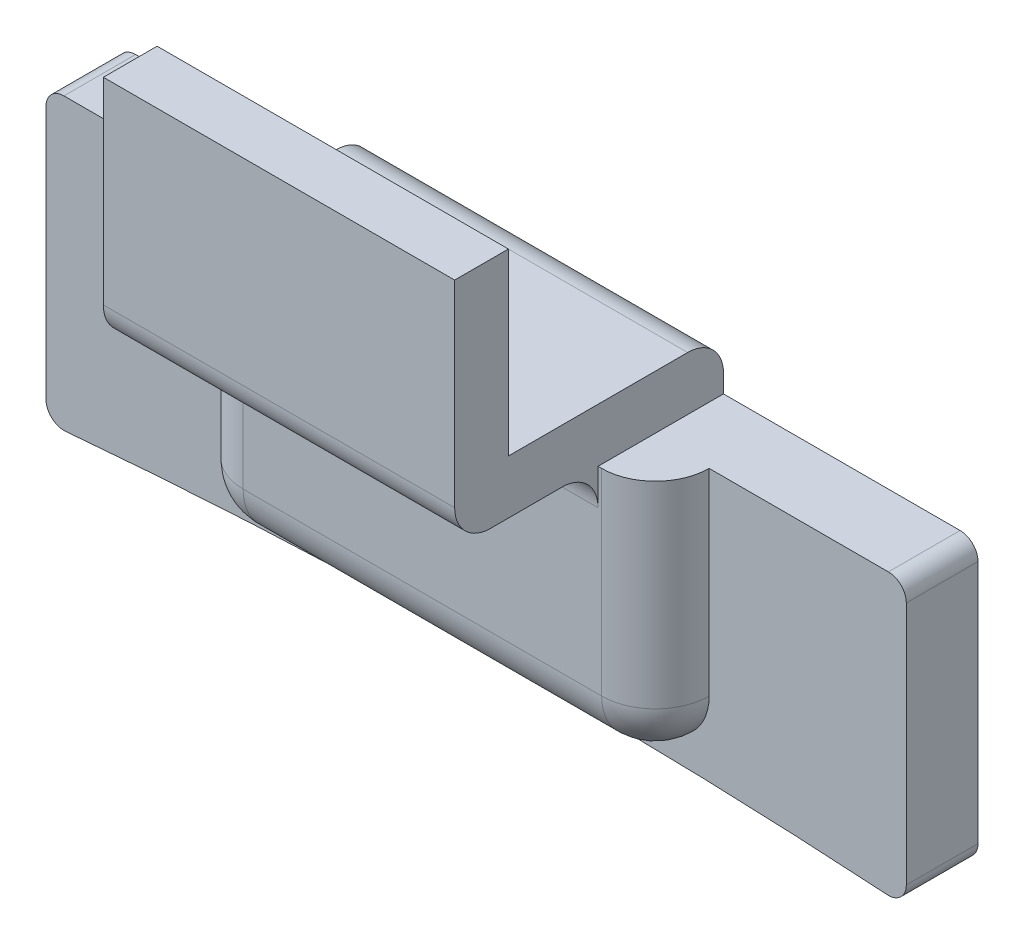
from build123d import *

# Parameters (mm, degrees)
BOSS_EXTRUDE1_DEPTH = 4
SKETCH4_W           = 26
SKETCH4_H           = 14
BOSS_EXTRUDE2_DEPTH = 3
FILLET1_R           = 1
FILLET3_R           = 3
FILLET4_R           = 3
SKETCH5_W           = 19.6
SKETCH5_H           = 7
BOSS_EXTRUDE3_DEPTH = 3
SKETCH8_W           = 19.6
SKETCH8_H           = 3
BOSS_EXTRUDE5_DEPTH = 5
SKETCH9_W           = 19.6
SKETCH9_H           = 3
BOSS_EXTRUDE6_DEPTH = 13
FILLET5_R           = 2


# Some blends are built 0.0001 mm under size
with BuildPart() as part:
    # Sketch1 → Boss-Extrude1 (new body)
    with BuildSketch(Plane(origin=(0, 0, 0), x_dir=(-1, 0, 0), z_dir=(0, 0, -1))):
        with BuildLine():
            Line((27.500000074, -16.263075607), (27.500000074, 0))
            Line((27.500000074, 0), (-20.499999926, 0))
            Line((-20.499999926, 0), (-20.499999926, -15.701236215))
            ThreePointArc((-20.499999926, -15.701236215), (3.511255672, -15.020548898), (27.500000074, -16.263075607))
        make_face()
    extrude(amount=-BOSS_EXTRUDE1_DEPTH)

    # Sketch4 → Boss-Extrude2 (add)
    with BuildSketch(Plane.XY.offset(4)):
        with Locations((-3.500000074, -7)):
            Rectangle(SKETCH4_W, SKETCH4_H)
    extrude(amount=BOSS_EXTRUDE2_DEPTH)

    # Fillet1
    fillet1_edges = [part.edges().sort_by_distance(p)[0] for p in [
        (20.499999926, 0, 2),
        (-27.500000074, 0, 2),
        (20.499999926, -15.701236215, 2),
        (-27.500000074, -16.263075607, 2),
    ]]
    fillet(fillet1_edges, radius=FILLET1_R)

    # Fillet3
    fillet3_edges = [part.edges().sort_by_distance(p)[0] for p in [
        (-3.500000074, -14, 7),
        (-16.500000074, -7, 7),
        (9.499999926, -7, 7),
    ]]
    fillet(fillet3_edges, radius=FILLET3_R - 0.0001)  # a hair under: the kernel refuses the full size

    # Fillet4
    # the kernel refuses this fillet: 3 mm, written as the material it takes off along each edge
    with BuildSketch(Plane(origin=(-13.500000074, -11, 7), x_dir=(-1, 0, 0), z_dir=(0, 1, 0))) as fillet4_piece_1:
        with BuildLine():
            CenterArc((0.0001, -2.9999), 2.9999, 0, 90)
            Line((3, -2.9999), (3, 0))
            Line((3, 0), (0.0001, 0))
        make_face()
    revolve(axis=Axis((-13.500000074, -11, 7), (0, 0, 1)), revolution_arc=90, mode=Mode.SUBTRACT)
    with BuildSketch(Plane(origin=(6.499999926, -11, 7), x_dir=(0, -1, 0), z_dir=(-1, 0, 0))) as fillet4_piece_2:
        with BuildLine():
            CenterArc((0.0001, -2.9999), 2.9999, 0, 90)
            Line((3, -2.9999), (3, 0))
            Line((3, 0), (0.0001, 0))
        make_face()
    revolve(axis=Axis((6.499999926, -11, 7), (0, 0, 1)), revolution_arc=90, mode=Mode.SUBTRACT)
    with BuildSketch(Plane(origin=(9.499999926, -14, 4), x_dir=(0, 1, 0), z_dir=(0, 0, 1))) as fillet4_piece_3:
        with BuildLine():
            CenterArc((FILLET4_R, FILLET4_R), FILLET4_R, 180, 90)
            Line((0, FILLET4_R), (0, 0))
            Line((0, 0), (FILLET4_R, 0))
        make_face()
    extrude(amount=3, mode=Mode.SUBTRACT)
    with BuildSketch(Plane(origin=(-16.500000074, -14, 4), x_dir=(0, 1, 0), z_dir=(0, 0, 1))) as fillet4_piece_4:
        with BuildLine():
            CenterArc((FILLET4_R, -FILLET4_R), FILLET4_R, 90, 90)
            Line((0, -FILLET4_R), (0, 0))
            Line((0, 0), (FILLET4_R, 0))
        make_face()
    extrude(amount=3, mode=Mode.SUBTRACT)

    # Sketch5 → Boss-Extrude3 (add)
    with BuildSketch(Plane(origin=(0, 0, 0), x_dir=(1, 0, 0), z_dir=(0, 1, 0))):
        with Locations((-3.500000074, -3.5)):
            Rectangle(SKETCH5_W, SKETCH5_H)
    extrude(amount=BOSS_EXTRUDE3_DEPTH)

    # Sketch8 → Boss-Extrude5 (add)
    with BuildSketch(Plane.XY.offset(7)):
        with Locations((-3.500000074, 1.5)):
            Rectangle(SKETCH8_W, SKETCH8_H)
    extrude(amount=BOSS_EXTRUDE5_DEPTH)

    # Sketch9 → Boss-Extrude6 (add)
    with BuildSketch(Plane.XZ):
        with Locations((-3.500000074, 13.5)):
            Rectangle(SKETCH9_W, SKETCH9_H)
    extrude(amount=-BOSS_EXTRUDE6_DEPTH)

    # Fillet5
    fillet5_edges = [part.edges().sort_by_distance(p)[0] for p in [
        (-3.500000074, 0, 15),
        (-3.500000074, 3, 0),
        (-3.500000074, 0, 7),
    ]]
    fillet(fillet5_edges, radius=FILLET5_R)


solid = part.part
